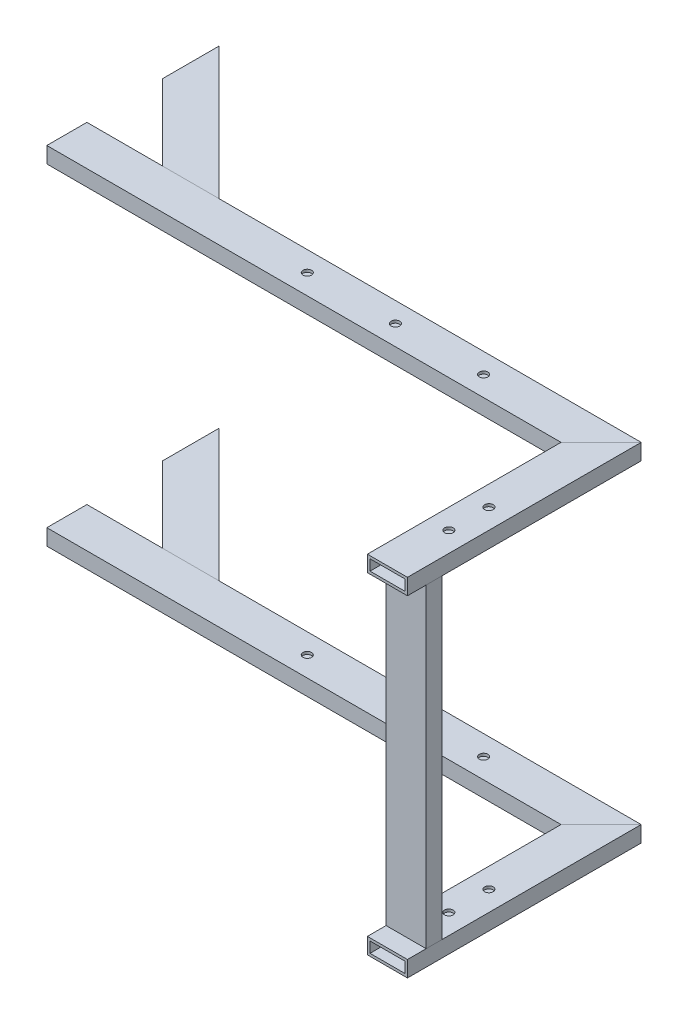
from build123d import *

# Parameters (mm, degrees)
F_20_START                   = -3
F_20_X_20_X_2_1_DEPTH        = 1
F_20_START_2                 = 2
F_20_X_20_X_2_1_2_DEPTH      = 1
F_20_START_3                 = -2
F_20_X_20_X_2_1_3_DEPTH      = 4
F_20_X_20_X_2_1_4_DEPTH      = 1
F_20_X_20_X_2_1_5_DEPTH      = 1
F_20_X_20_X_2_1_6_DEPTH      = 4
F_20_START_4                 = -126.91
F_20_X_20_X_2_1_7_DEPTH      = 1
F_20_START_5                 = -121.91
F_20_X_20_X_2_1_8_DEPTH      = 1
F_20_START_6                 = -125.91
F_20_X_20_X_2_1_9_DEPTH      = 4
F_20_X_20_X_2_1_10_DEPTH     = 1
F_20_X_20_X_2_1_11_DEPTH     = 1
F_20_X_20_X_2_1_12_DEPTH     = 4
F_20_START_7                 = 192.5
F_20_X_20_X_2_1_13_OUTLINE_W = 117.91
F_20_X_20_X_2_1_13_OUTLINE_H = 1
F_20_X_20_X_2_1_13_DEPTH     = 15
F_20_X_20_X_2_1_14_OUTLINE_W = 117.91
F_20_X_20_X_2_1_14_OUTLINE_H = 4
F_20_X_20_X_2_1_14_DEPTH     = 1
F_20_START_8                 = 206.5
F_20_X_20_X_2_1_15_OUTLINE_W = 117.91
F_20_X_20_X_2_1_15_OUTLINE_H = 4
F_20_X_20_X_2_1_15_DEPTH     = 1
F_20_X_20_X_2_1_16_DEPTH     = 1
F_20_X_20_X_2_1_17_DEPTH     = 1
F_20_X_20_X_2_1_18_DEPTH     = 4
F_20_X_20_X_2_1_19_DEPTH     = 1
F_20_X_20_X_2_1_20_DEPTH     = 1
F_20_X_20_X_2_1_21_DEPTH     = 4
SKETCH_1_W                   = 27.555154476
SKETCH_1_H                   = 101.124473491
CUT_EXTRUDE_1_DEPTH          = 258.551661031
SKETCH_2_R                   = 1.6
CUT_EXTRUDE_2_DEPTH          = 258.551661031


# Read off the part's stored shape, not the designer's step: 方形管 20 X 20 X 2(1)
with BuildPart() as part:
    # 方形管 20 X 20 X 2(1) outline → 方形管 20 X 20 X 2(1) (new body)
    with BuildSketch(Plane(origin=(0, 0, 0), x_dir=(1, 0, 0), z_dir=(0, 1, 0)).offset(F_20_START)):
        Polygon((192.5, -7.5), (192.5, -80), (207.5, -80), (207.5, 7.5), align=None)
    extrude(amount=F_20_X_20_X_2_1_DEPTH)

    # 20 X 20 X 2_1 2 outline → 20 X 20 X 2_1 2 (add)
    with BuildSketch(Plane(origin=(0, 0, 0), x_dir=(1, 0, 0), z_dir=(0, 1, 0)).offset(F_20_START_2)):
        Polygon((192.5, -7.5), (192.5, -80), (207.5, -80), (207.5, 7.5), align=None)
    extrude(amount=F_20_X_20_X_2_1_2_DEPTH)

    # 20 X 20 X 2_1 3 outline → 20 X 20 X 2_1 3 (add)
    with BuildSketch(Plane(origin=(0, 0, 0), x_dir=(1, 0, 0), z_dir=(0, 1, 0)).offset(F_20_START_3)):
        Polygon((192.5, -7.5), (192.5, -80), (193.5, -80), (193.5, -6.5), align=None)
        Polygon((206.5, 6.5), (206.5, -80), (207.5, -80), (207.5, 7.5), align=None)
    extrude(amount=F_20_X_20_X_2_1_3_DEPTH)


with BuildPart() as body_2:
    # 20 X 20 X 2_1 4 outline → 20 X 20 X 2_1 4 (new body)
    with BuildSketch(Plane(origin=(0, 0, 0), x_dir=(1, 0, 0), z_dir=(0, 1, 0)).offset(F_20_START)):
        Polygon((0, -7.5), (192.5, -7.5), (207.5, 7.5), (0, 7.5), align=None)
    extrude(amount=F_20_X_20_X_2_1_4_DEPTH)

    # 20 X 20 X 2_1 5 outline → 20 X 20 X 2_1 5 (add)
    with BuildSketch(Plane(origin=(0, 0, 0), x_dir=(1, 0, 0), z_dir=(0, 1, 0)).offset(F_20_START_2)):
        Polygon((0, -7.5), (192.5, -7.5), (207.5, 7.5), (0, 7.5), align=None)
    extrude(amount=F_20_X_20_X_2_1_5_DEPTH)

    # 20 X 20 X 2_1 6 outline → 20 X 20 X 2_1 6 (add)
    with BuildSketch(Plane(origin=(0, 0, 0), x_dir=(1, 0, 0), z_dir=(0, 1, 0)).offset(F_20_START_3)):
        Polygon((0, -7.5), (192.5, -7.5), (193.5, -6.5), (0, -6.5), align=None)
        Polygon((0, 6.5), (206.5, 6.5), (207.5, 7.5), (0, 7.5), align=None)
    extrude(amount=F_20_X_20_X_2_1_6_DEPTH)


with BuildPart() as body_3:
    # 20 X 20 X 2_1 7 outline → 20 X 20 X 2_1 7 (new body)
    with BuildSketch(Plane(origin=(0, 0, 0), x_dir=(1, 0, 0), z_dir=(0, 1, 0)).offset(F_20_START_4)):
        Polygon((0, -7.5), (192.5, -7.5), (207.5, 7.5), (0, 7.5), align=None)
    extrude(amount=F_20_X_20_X_2_1_7_DEPTH)

    # 20 X 20 X 2_1 8 outline → 20 X 20 X 2_1 8 (add)
    with BuildSketch(Plane(origin=(0, 0, 0), x_dir=(1, 0, 0), z_dir=(0, 1, 0)).offset(F_20_START_5)):
        Polygon((0, -7.5), (192.5, -7.5), (207.5, 7.5), (0, 7.5), align=None)
    extrude(amount=F_20_X_20_X_2_1_8_DEPTH)

    # 20 X 20 X 2_1 9 outline → 20 X 20 X 2_1 9 (add)
    with BuildSketch(Plane(origin=(0, 0, 0), x_dir=(1, 0, 0), z_dir=(0, 1, 0)).offset(F_20_START_6)):
        Polygon((0, -7.5), (192.5, -7.5), (193.5, -6.5), (0, -6.5), align=None)
        Polygon((0, 6.5), (206.5, 6.5), (207.5, 7.5), (0, 7.5), align=None)
    extrude(amount=F_20_X_20_X_2_1_9_DEPTH)


with BuildPart() as body_4:
    # 20 X 20 X 2_1 10 outline → 20 X 20 X 2_1 10 (new body)
    with BuildSketch(Plane(origin=(0, 0, 0), x_dir=(1, 0, 0), z_dir=(0, 1, 0)).offset(F_20_START_4)):
        Polygon((192.5, -7.5), (192.5, -80), (207.5, -80), (207.5, 7.5), align=None)
    extrude(amount=F_20_X_20_X_2_1_10_DEPTH)

    # 20 X 20 X 2_1 11 outline → 20 X 20 X 2_1 11 (add)
    with BuildSketch(Plane(origin=(0, 0, 0), x_dir=(1, 0, 0), z_dir=(0, 1, 0)).offset(F_20_START_5)):
        Polygon((192.5, -7.5), (192.5, -80), (207.5, -80), (207.5, 7.5), align=None)
    extrude(amount=F_20_X_20_X_2_1_11_DEPTH)

    # 20 X 20 X 2_1 12 outline → 20 X 20 X 2_1 12 (add)
    with BuildSketch(Plane(origin=(0, 0, 0), x_dir=(1, 0, 0), z_dir=(0, 1, 0)).offset(F_20_START_6)):
        Polygon((192.5, -7.5), (192.5, -80), (193.5, -80), (193.5, -6.5), align=None)
        Polygon((206.5, 6.5), (206.5, -80), (207.5, -80), (207.5, 7.5), align=None)
    extrude(amount=F_20_X_20_X_2_1_12_DEPTH)


with BuildPart() as body_5:
    # 20 X 20 X 2_1 13 outline → 20 X 20 X 2_1 13 (new body)
    with BuildSketch(Plane.YZ.offset(F_20_START_7)):
        with Locations((-61.955, 72.5)):
            Rectangle(F_20_X_20_X_2_1_13_OUTLINE_W, F_20_X_20_X_2_1_13_OUTLINE_H)
        with Locations((-61.955, 67.5)):
            Rectangle(F_20_X_20_X_2_1_13_OUTLINE_W, F_20_X_20_X_2_1_13_OUTLINE_H)
    extrude(amount=F_20_X_20_X_2_1_13_DEPTH)

    # 20 X 20 X 2_1 14 outline → 20 X 20 X 2_1 14 (add)
    with BuildSketch(Plane.YZ.offset(F_20_START_7)):
        with Locations((-61.955, 70)):
            Rectangle(F_20_X_20_X_2_1_14_OUTLINE_W, F_20_X_20_X_2_1_14_OUTLINE_H)
    extrude(amount=F_20_X_20_X_2_1_14_DEPTH)

    # 20 X 20 X 2_1 15 outline → 20 X 20 X 2_1 15 (add)
    with BuildSketch(Plane.YZ.offset(F_20_START_8)):
        with Locations((-61.955, 70)):
            Rectangle(F_20_X_20_X_2_1_15_OUTLINE_W, F_20_X_20_X_2_1_15_OUTLINE_H)
    extrude(amount=F_20_X_20_X_2_1_15_DEPTH)


with BuildPart() as body_6:
    # 20 X 20 X 2_1 16 outline → 20 X 20 X 2_1 16 (new body)
    with BuildSketch(Plane(origin=(0, 0, 0), x_dir=(1, 0, 0), z_dir=(0, 1, 0)).offset(F_20_START)):
        Polygon((28.284271247, 7.5), (49.497474683, 7.5), (0, 56.997474683), (-10.606601718, 46.390872965), align=None)
    extrude(amount=F_20_X_20_X_2_1_16_DEPTH)

    # 20 X 20 X 2_1 17 outline → 20 X 20 X 2_1 17 (add)
    with BuildSketch(Plane(origin=(0, 0, 0), x_dir=(1, 0, 0), z_dir=(0, 1, 0)).offset(F_20_START_2)):
        Polygon((28.284271247, 7.5), (49.497474683, 7.5), (0, 56.997474683), (-10.606601718, 46.390872965), align=None)
    extrude(amount=F_20_X_20_X_2_1_17_DEPTH)

    # 20 X 20 X 2_1 18 outline → 20 X 20 X 2_1 18 (add)
    with BuildSketch(Plane(origin=(0, 0, 0), x_dir=(1, 0, 0), z_dir=(0, 1, 0)).offset(F_20_START_3)):
        Polygon((28.284271247, 7.5), (29.69848481, 7.5), (-9.899494937, 47.097979746), (-10.606601718, 46.390872965), align=None)
        Polygon((-0.707106781, 56.290367902), (48.083261121, 7.5), (49.497474683, 7.5), (0, 56.997474683), align=None)
    extrude(amount=F_20_X_20_X_2_1_18_DEPTH)


with BuildPart() as body_7:
    # 20 X 20 X 2_1 19 outline → 20 X 20 X 2_1 19 (new body)
    with BuildSketch(Plane(origin=(0, 0, 0), x_dir=(1, 0, 0), z_dir=(0, 1, 0)).offset(F_20_START_4)):
        Polygon((28.284271247, 7.5), (49.497474683, 7.5), (0, 56.997474683), (-10.606601718, 46.390872965), align=None)
    extrude(amount=F_20_X_20_X_2_1_19_DEPTH)

    # 20 X 20 X 2_1 20 outline → 20 X 20 X 2_1 20 (add)
    with BuildSketch(Plane(origin=(0, 0, 0), x_dir=(1, 0, 0), z_dir=(0, 1, 0)).offset(F_20_START_5)):
        Polygon((28.284271247, 7.5), (49.497474683, 7.5), (0, 56.997474683), (-10.606601718, 46.390872965), align=None)
    extrude(amount=F_20_X_20_X_2_1_20_DEPTH)

    # 20 X 20 X 2_1 21 outline → 20 X 20 X 2_1 21 (add)
    with BuildSketch(Plane(origin=(0, 0, 0), x_dir=(1, 0, 0), z_dir=(0, 1, 0)).offset(F_20_START_6)):
        Polygon((28.284271247, 7.5), (29.69848481, 7.5), (-9.899494937, 47.097979746), (-10.606601718, 46.390872965), align=None)
        Polygon((-0.707106781, 56.290367902), (48.083261121, 7.5), (49.497474683, 7.5), (0, 56.997474683), align=None)
    extrude(amount=F_20_X_20_X_2_1_21_DEPTH)


with BuildPart() as cut_extrude_1_tool:
    # 草图1 → 切除-拉伸1 (new, through all)
    with BuildSketch(Plane(origin=(0, 3, 0), x_dir=(1, 0, 0), z_dir=(0, 1, 0))):
        with Locations((-13.777577238, 43.062236746)):
            Rectangle(SKETCH_1_W, SKETCH_1_H)
    extrude(amount=-CUT_EXTRUDE_1_DEPTH)


with BuildPart() as body_6_1:
    add(body_6.part)

    # 切除-拉伸1: cut by cut_extrude_1_tool
    add(cut_extrude_1_tool.part, mode=Mode.SUBTRACT)


with BuildPart() as body_7_1:
    add(body_7.part)

    # 切除-拉伸1: cut by cut_extrude_1_tool
    add(cut_extrude_1_tool.part, mode=Mode.SUBTRACT)


with BuildPart() as cut_extrude_2_tool:
    # 草图2 → 切除-拉伸2 (new, through all)
    with BuildSketch(Plane(origin=(0, 3, 0), x_dir=(1, 0, 0), z_dir=(0, 1, 0))):
        with Locations(Location((200, -57, 0), (0, 0, 270))):
            Circle(SKETCH_2_R)
        with Locations(Location((200, -42, 0), (0, 0, 270))):
            Circle(SKETCH_2_R)
        with Locations(Location((156, 0, 0), (0, 0, 270))):
            Circle(SKETCH_2_R)
        with Locations(Location((123, 0, 0), (0, 0, 270))):
            Circle(SKETCH_2_R)
        with Locations(Location((90, 0, 0), (0, 0, 270))):
            Circle(SKETCH_2_R)
    extrude(amount=-CUT_EXTRUDE_2_DEPTH)


with BuildPart() as part_1:
    add(part.part)

    # 切除-拉伸2: cut by cut_extrude_2_tool
    add(cut_extrude_2_tool.part, mode=Mode.SUBTRACT)


with BuildPart() as body_2_1:
    add(body_2.part)

    # 切除-拉伸2: cut by cut_extrude_2_tool
    add(cut_extrude_2_tool.part, mode=Mode.SUBTRACT)


with BuildPart() as body_3_1:
    add(body_3.part)

    # 切除-拉伸2: cut by cut_extrude_2_tool
    add(cut_extrude_2_tool.part, mode=Mode.SUBTRACT)


with BuildPart() as body_4_1:
    add(body_4.part)

    # 切除-拉伸2: cut by cut_extrude_2_tool
    add(cut_extrude_2_tool.part, mode=Mode.SUBTRACT)


solid = Compound([body_5.part, body_6_1.part, body_7_1.part, part_1.part, body_2_1.part, body_3_1.part, body_4_1.part])
